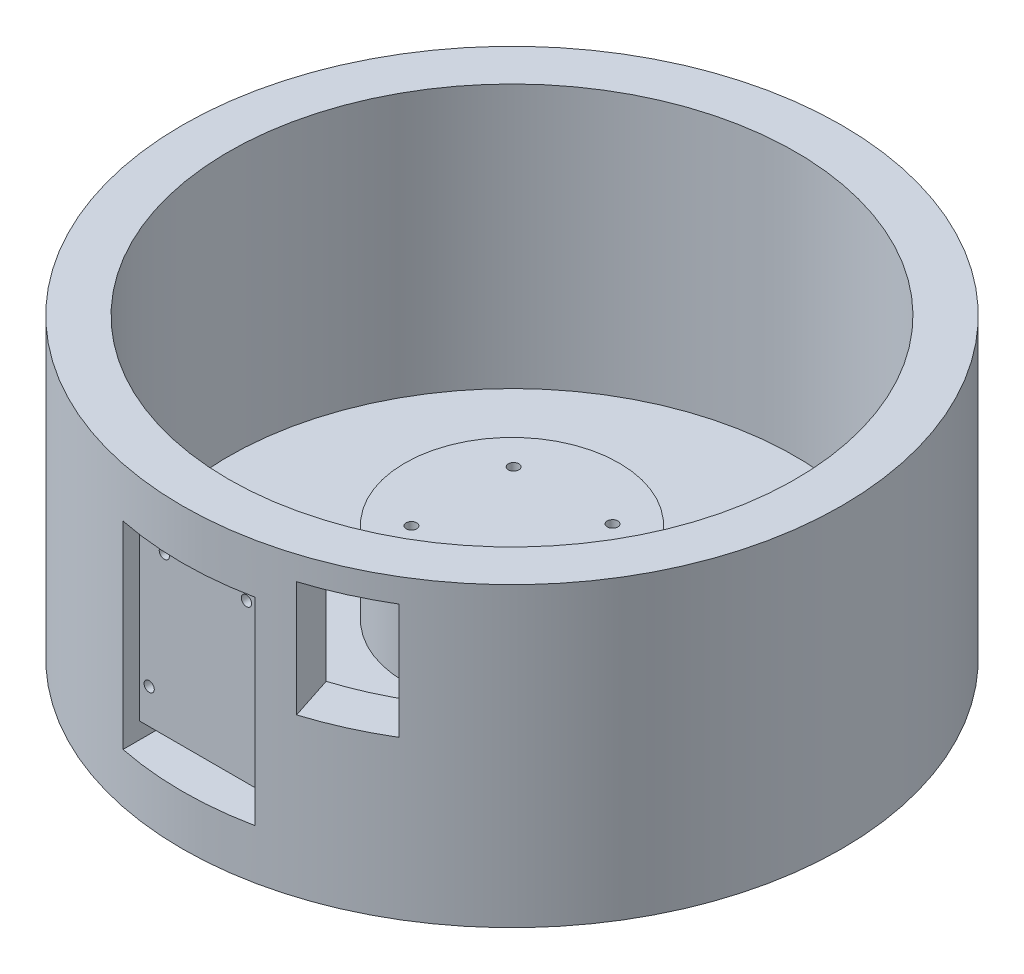
from build123d import *

# Parameters (mm, degrees)
SKETCH1_R               = 100
BOSS_EXTRUDE3_DEPTH     = 90
CUT_EXTRUDE2_DEPTH      = 26
CUT_EXTRUDE2_DEPTH_BACK = 12
SKETCH4_W               = 40
SKETCH4_H               = 60
BOSS_EXTRUDE4_START     = 0.1
SKETCH12_R              = 100
BOSS_EXTRUDE4_DEPTH     = 0.1
SKETCH13_R              = 86
CUT_EXTRUDE8_DEPTH      = 80
SKETCH18_R              = 32.5
BOSS_EXTRUDE5_DEPTH     = 25
SKETCH16_R              = 1.6
CUT_EXTRUDE11_DEPTH     = 168.684256864
SKETCH17_R              = 3
CUT_EXTRUDE12_DEPTH     = 30
SKETCH19_R              = 30
CUT_EXTRUDE13_DEPTH     = 25
SKETCH20_W              = 40
SKETCH20_H              = 5
CUT_EXTRUDE14_DEPTH     = 25
SKETCH21_R              = 1.55
CUT_EXTRUDE15_DEPTH     = 25
CUT_EXTRUDE16_DEPTH     = 35


with BuildPart() as part:
    # Sketch1 → Boss-Extrude3 (new body)
    with BuildSketch(Plane(origin=(0, 0, 0), x_dir=(1, 0, 0), z_dir=(0, 1, 0))):
        Circle(SKETCH1_R)
    extrude(amount=BOSS_EXTRUDE3_DEPTH)

    # Sketch4 → Cut-Extrude2 (cut, two sides: drawn at the far end of the back side and taken through both)
    with BuildSketch(Plane.XY.offset(105).offset(-CUT_EXTRUDE2_DEPTH_BACK)):
        with Locations((0, 45)):
            Rectangle(SKETCH4_W, SKETCH4_H)
    extrude(amount=CUT_EXTRUDE2_DEPTH + CUT_EXTRUDE2_DEPTH_BACK, mode=Mode.SUBTRACT)

    # Sketch12 → Boss-Extrude4 (add)
    with BuildSketch(Plane.XZ.offset(BOSS_EXTRUDE4_START)):
        Circle(SKETCH12_R)
    extrude(amount=-BOSS_EXTRUDE4_DEPTH)

    # Sketch13 → Cut-Extrude8 (cut)
    with BuildSketch(Plane(origin=(0, 90, 0), x_dir=(1, 0, 0), z_dir=(0, 1, 0))):
        Circle(SKETCH13_R)
    extrude(amount=-CUT_EXTRUDE8_DEPTH, mode=Mode.SUBTRACT)

    # Sketch18 → Boss-Extrude5 (add)
    with BuildSketch(Plane(origin=(0, 10, 0), x_dir=(1, 0, 0), z_dir=(0, 1, 0))):
        Circle(SKETCH18_R)
    extrude(amount=BOSS_EXTRUDE5_DEPTH)

    # Sketch16 → Cut-Extrude11 (cut, through all)
    with BuildSketch(Plane.XZ.offset(0.1)):
        with Locations((-15, 15.5)):
            Circle(SKETCH16_R)
        with Locations((15, 15.5)):
            Circle(SKETCH16_R)
        with Locations((15, -15.5)):
            Circle(SKETCH16_R)
        with Locations((-15, -15.5)):
            Circle(SKETCH16_R)
    extrude(amount=-CUT_EXTRUDE11_DEPTH, mode=Mode.SUBTRACT)

    # Sketch17 → Cut-Extrude12 (cut)
    with BuildSketch(Plane.XZ.offset(0.1)):
        with Locations((-15, 15.5)):
            Circle(SKETCH17_R)
        with Locations((15, 15.5)):
            Circle(SKETCH17_R)
        with Locations((-15, -15.5)):
            Circle(SKETCH17_R)
        with Locations((15, -15.5)):
            Circle(SKETCH17_R)
    extrude(amount=-CUT_EXTRUDE12_DEPTH, mode=Mode.SUBTRACT)

    # Sketch19 → Cut-Extrude13 (cut)
    with BuildSketch(Plane.XZ.offset(0.1)):
        Circle(SKETCH19_R)
    extrude(amount=-CUT_EXTRUDE13_DEPTH, mode=Mode.SUBTRACT)

    # Sketch20 → Cut-Extrude14 (cut)
    with BuildSketch(Plane.XY.offset(93)):
        with Locations((0, 17.5)):
            Rectangle(SKETCH20_W, SKETCH20_H)
    extrude(amount=-CUT_EXTRUDE14_DEPTH, mode=Mode.SUBTRACT)

    # Sketch21 → Cut-Extrude15 (cut)
    with BuildSketch(Plane.XY.offset(93)):
        with Locations((12.45, 67.8)):
            Circle(SKETCH21_R)
        with Locations((-12.45, 67.8)):
            Circle(SKETCH21_R)
        with Locations((-17.05, 30.54)):
            Circle(SKETCH21_R)
        with Locations((17.05, 30.54)):
            Circle(SKETCH21_R)
    extrude(amount=-CUT_EXTRUDE15_DEPTH, mode=Mode.SUBTRACT)

    # Sketch22 → Cut-Extrude16 (cut)
    with BuildSketch(Plane(origin=(22.204096953, 47.794122581, -296.404157649), x_dir=(1, 0, 0), z_dir=(0, 1, 0))):
        Polygon((-6.791929493, -346.959107226), (12.404969277, -405.762485644), (37.058002756, -394.3841625), (3.953655983, -342.212063172), align=None)
    extrude(amount=CUT_EXTRUDE16_DEPTH, mode=Mode.SUBTRACT)


solid = part.part
